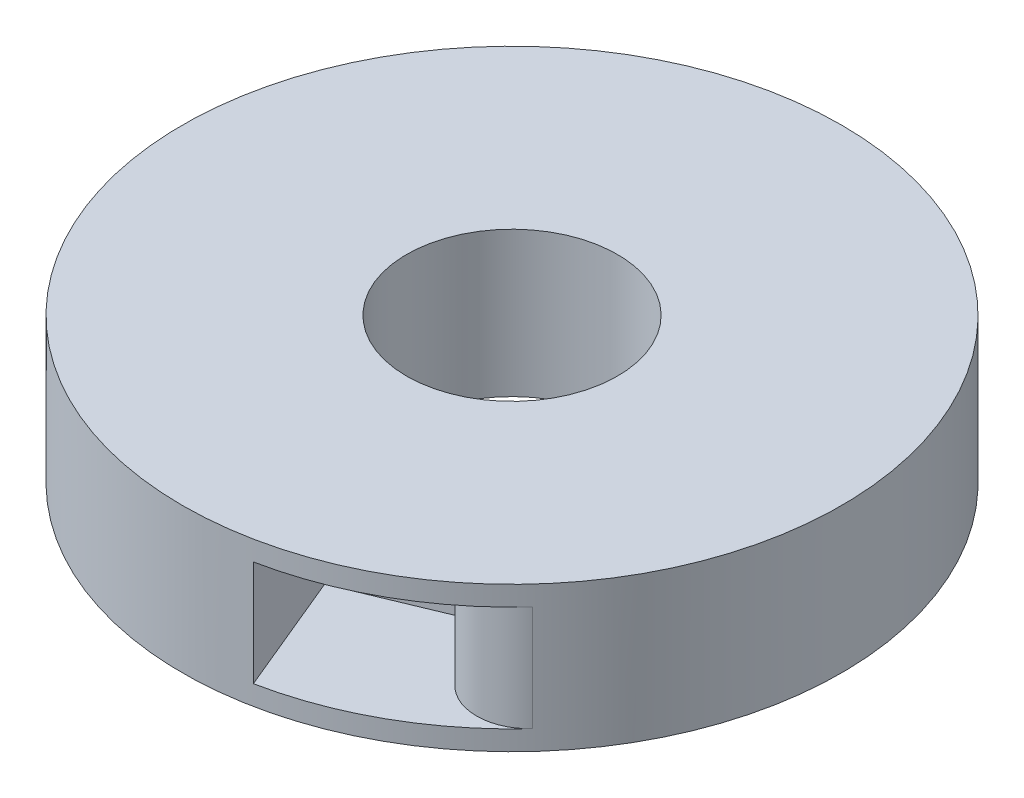
from build123d import *

# Parameters (mm, degrees)
BOSS_EXTRUDE1_DEPTH = 8
SKETCH2_R           = 25
BOSS_EXTRUDE2_DEPTH = 1.5
BOSS_EXTRUDE3_START = 1.5
SKETCH3_R           = 25
BOSS_EXTRUDE3_DEPTH = 1.5
SKETCH4_R           = 8
CUT_EXTRUDE1_DEPTH  = 38.027017163
FILLET1_R           = 4


with BuildPart() as part:
    # Sketch1 → Boss-Extrude1 (new body)
    with BuildSketch(Plane(origin=(0, 0, 0), x_dir=(1, 0, 0), z_dir=(0, 1, 0))):
        with BuildLine():
            ThreePointArc((-13.903357517, 20.777310936), (-23.090394822, -9.582988415), (4.894388058, -24.516218418))
            Line((4.894388058, -24.516218418), (1.061192692, -15.28006049))
            Line((1.061192692, -15.28006049), (10.070162151, -11.541153008))
            Line((10.070162151, -11.541153008), (13.903357517, -20.777310936))
            ThreePointArc((13.903357517, -20.777310936), (22.052028681, -11.777437371), (25, 0))
            ThreePointArc((25, 0), (15.85308012, 19.330800571), (-4.894388058, 24.516218418))
            Line((-4.894388058, 24.516218418), (-1.061192692, 15.28006049))
            Line((-1.061192692, 15.28006049), (-10.070162151, 11.541153008))
            Line((-10.070162151, 11.541153008), (-13.903357517, 20.777310936))
        make_face()
    extrude(amount=BOSS_EXTRUDE1_DEPTH)

    # Sketch2 → Boss-Extrude2 (add)
    with BuildSketch(Plane(origin=(0, 8, 0), x_dir=(1, 0, 0), z_dir=(0, 1, 0))):
        with Locations(Location((0, 0, 0), (0, 0, 101.290031001))):
            Circle(SKETCH2_R)
    extrude(amount=BOSS_EXTRUDE2_DEPTH)

    # Sketch3 → Boss-Extrude3 (add)
    with BuildSketch(Plane(origin=(0, 0, 0), x_dir=(-1, 0, 0), z_dir=(0, -1, 0)).offset(BOSS_EXTRUDE3_START)):
        with Locations(Location((0, 0, 0), (0, 0, 90))):
            Circle(SKETCH3_R)
    extrude(amount=-BOSS_EXTRUDE3_DEPTH)

    # Sketch4 → Cut-Extrude1 (cut, through all)
    with BuildSketch(Plane(origin=(0, 9.5, 0), x_dir=(1, 0, 0), z_dir=(0, 1, 0))):
        with Locations(Location((0, 0, 0), (0, 0, 270))):
            Circle(SKETCH4_R)
    extrude(amount=-CUT_EXTRUDE1_DEPTH, mode=Mode.SUBTRACT)

    # Fillet1
    # the kernel refuses this fillet: 4 mm, written as the material it takes off along each edge
    with BuildSketch(Plane(origin=(-13.903357517, 0, -20.777310936), x_dir=(-0.7585073029856567, 0, 0.6516645389442524), z_dir=(0, 1, 0)), Plane(origin=(13.903357517, 0, 20.777310936), x_dir=(0.7585073029856618, 0, -0.6516645389442466), z_dir=(0, 1, 0))) as fillet1_piece_1:
        with BuildLine():
            CenterArc((5.509030911, 3.971210744), FILLET1_R, 161.872235739, 115.006104931)
            Line((1.707570619, 5.215758711), (0, 0))
            ThreePointArc((0, 0), (2.994038539, -0.179932852), (5.988077078, 0))
        make_face()
    extrude(amount=8, mode=Mode.SUBTRACT)


solid = part.part
